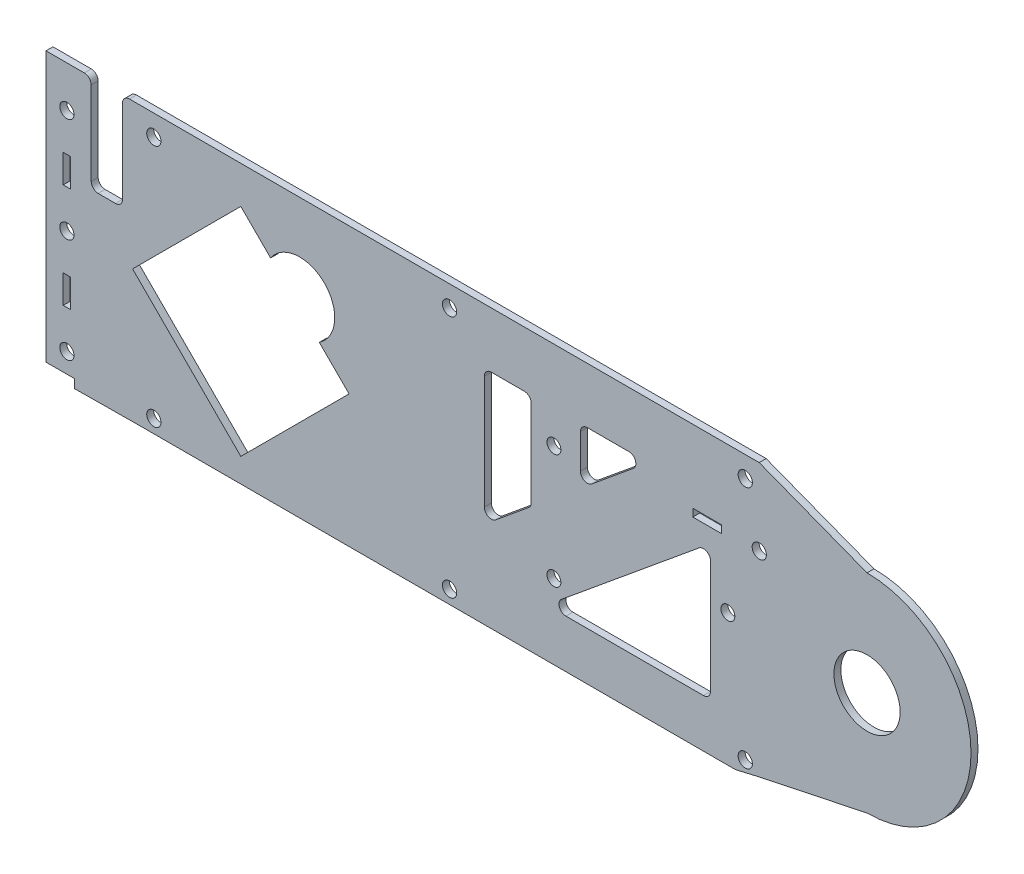
from build123d import *

# Parameters (mm, degrees)
SKETCH_1_R          = 2.05
SKETCH_1_W          = 2.1
SKETCH_1_H          = 8.1
SKETCH_1_R_2        = 9.525
EXTRUDE_1_DEPTH     = 2
FILLET_1_R          = 2
SKETCH_3_R          = 2.05
SKETCH_3_R_2        = 2
SKETCH_3_W          = 8.2
SKETCH_3_H          = 2.2
CUT_EXTRUDE_1_DEPTH = 2
FILLET_2_R          = 2


with BuildPart() as part:
    # 草图1 → 凸台-拉伸1 (new body)
    with BuildSketch(Plane.XY):
        with BuildLine():
            Line((199.556073527, -36.55591431), (230.542857143, -30.045714286))
            ThreePointArc((230.542857143, -30.045714286), (260.442857143, -0.145714286), (230.542857143, 29.754285714))
            Line((230.542857143, 29.754285714), (199.542857143, 41.704285714))
            Line((199.542857143, 41.704285714), (16.542857143, 41.704285714))
            Line((16.542857143, 41.704285714), (16.542857143, 13.704285714))
            Line((16.542857143, 13.704285714), (7.542857143, 13.704285714))
            Line((7.542857143, 13.704285714), (7.542857143, 41.704285714))
            Line((7.542857143, 41.704285714), (-5.457142857, 41.704285714))
            Line((-5.457142857, 41.704285714), (-5.457142857, -35.802553436))
            Line((-5.457142857, -35.802553436), (2.692857143, -35.802553436))
            Line((2.692857143, -35.802553436), (2.692857143, -38.295714286))
            Line((2.692857143, -38.295714286), (21.365844759, -38.145714286))
            Line((21.365844759, -38.145714286), (192.746868021, -38.145714286))
            Line((192.746868021, -38.145714286), (199.556073527, -36.55591431))
        make_face()
        with Locations((0.542857143, -30.145714286)):
            Circle(SKETCH_1_R, mode=Mode.SUBTRACT)
        with Locations((0.542857143, -15.145714286)):
            Rectangle(SKETCH_1_W, SKETCH_1_H, mode=Mode.SUBTRACT)
        with Locations((0.542857143, -0.145714286)):
            Circle(SKETCH_1_R, mode=Mode.SUBTRACT)
        with BuildLine():
            Line((50.542857143, 30.966984086), (59.099206329, 22.4106349))
            ThreePointArc((59.099206329, 22.4106349), (74.584487703, 23.895916275), (73.099206329, 8.4106349))
            Line((73.099206329, 8.4106349), (81.655555515, -0.145714286))
            Line((81.655555515, -0.145714286), (50.542857143, -31.258412658))
            Line((50.542857143, -31.258412658), (19.430158771, -0.145714286))
            Line((19.430158771, -0.145714286), (50.542857143, 30.966984086))
        make_face(mode=Mode.SUBTRACT)
        with Locations((230.542857143, -0.145714286)):
            Circle(SKETCH_1_R_2, mode=Mode.SUBTRACT)
        with Locations((0.542857143, 14.854285714)):
            Rectangle(SKETCH_1_W, SKETCH_1_H, mode=Mode.SUBTRACT)
        with BuildLine():
            ThreePointArc((0.542857143, 27.804285714), (-1.507142857, 29.854285714), (0.542857143, 31.904285714))
            ThreePointArc((0.542857143, 31.904285714), (1.992426044, 31.303854616), (2.592857143, 29.854285714))
            ThreePointArc((2.592857143, 29.854285714), (1.992426044, 28.404716813), (0.542857143, 27.804285714))
        make_face(mode=Mode.SUBTRACT)
    extrude(amount=EXTRUDE_1_DEPTH)

    # 圆角1
    fillet_1_edges = [part.edges().sort_by_distance(p)[0] for p in [
        (16.542857143, 41.704285714, 1),
        (7.542857143, 41.704285714, 1),
        (7.542857143, 13.704285714, 1),
        (16.542857143, 13.704285714, 1),
    ]]
    fillet(fillet_1_edges, radius=FILLET_1_R)

    # 草图3 → 切除-拉伸1 (cut)
    with BuildSketch(Plane.XY.offset(2)):
        with Locations((25.542857143, 35.704285714)):
            Circle(SKETCH_3_R)
        with Locations((110.542857143, 35.704285714)):
            Circle(SKETCH_3_R)
        with Locations((195.542857143, 35.704285714)):
            Circle(SKETCH_3_R)
        with Locations((110.542857143, -34.295714286)):
            Circle(SKETCH_3_R)
        with Locations((195.542857143, -34.295714286)):
            Circle(SKETCH_3_R)
        with Locations((25.542857143, -34.295714286)):
            Circle(SKETCH_3_R)
        with Locations((190.542857143, -0.145714286)):
            Circle(SKETCH_3_R_2)
        with Locations((140.542857143, 16.354285714)):
            Circle(SKETCH_3_R_2)
        with Locations((140.542857143, -16.645714286)):
            Circle(SKETCH_3_R_2)
        with Locations((199.574018739, 19.704285714)):
            Circle(SKETCH_3_R)
        Polygon((148.153334198, 25.704285714), (148.153334198, 9.632158315), (167.669488896, 25.704285714), align=None)
        Polygon((185.542857143, -24.295714286), (138.41622539, -24.295714286), (185.542857143, 14.51445304), align=None)
        Polygon((120.542857143, -13.105881612), (120.542857143, 25.704285714), (134.014872528, 25.704285714), (134.014872528, -2.011280706), align=None)
        with Locations((184.574018739, 19.704285714)):
            Rectangle(SKETCH_3_W, SKETCH_3_H)
    extrude(amount=-CUT_EXTRUDE_1_DEPTH, mode=Mode.SUBTRACT)

    # 圆角2
    fillet_2_edges = [part.edges().sort_by_distance(p)[0] for p in [
        (134.014872528, -2.011280706, 1),
        (134.014872528, 25.704285714, 1),
        (120.542857143, 25.704285714, 1),
        (120.542857143, -13.105881612, 1),
        (185.542857143, -24.295714286, 1),
        (185.542857143, 14.51445304, 1),
        (138.41622539, -24.295714286, 1),
        (148.153334198, 9.632158315, 1),
        (148.153334198, 25.704285714, 1),
        (167.669488896, 25.704285714, 1),
    ]]
    fillet(fillet_2_edges, radius=FILLET_2_R)


solid = part.part
